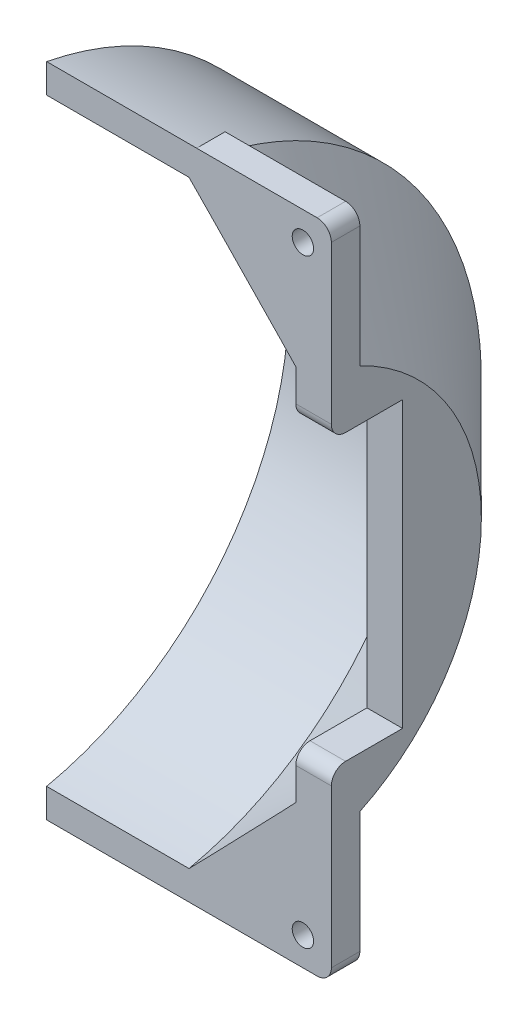
from build123d import *

# Parameters (mm, degrees)
CUT_EXTRUDE1_DEPTH      = 78.575769413
CUT_EXTRUDE1_DEPTH_BACK = 9
SKETCH2_W               = 40
SKETCH2_H               = 94
SKETCH3_W               = 10
SKETCH3_H               = 40
CUT_EXTRUDE2_DEPTH      = 78.05193054
SKETCH4_R               = 1.5
BOSS_EXTRUDE1_DEPTH     = 4
MOVE_START              = -46.130250379
MOVE_FACE1_OUTLINE_W    = 16.928932188
MOVE_FACE1_OUTLINE_H    = 4
MOVE_FACE1_DEPTH        = 0.963891216
MOVE_START_2            = 45.166359163
MOVE_FACE1_2_OUTLINE_W  = 16.928932188
MOVE_FACE1_2_OUTLINE_H  = 4
MOVE_FACE1_2_DEPTH      = 0.963891216
MOVE_START_3            = -28.692666648
MOVE_FACE1_3_DEPTH      = 1.57682047
MOVE_START_4            = 27.115846178
MOVE_FACE1_4_DEPTH      = 1.57682047
FILLET1_R               = 2


with BuildPart() as part:
    # Sketch1 → Revolve1 (revolve)
    with BuildSketch(Plane.XY, mode=Mode.PRIVATE) as revolve1_sk:
        Polygon((0, 47), (23.071067812, 47), (40, 30.071067812), (40, 0), (35, 0), (35, 28), (20, 43), (0, 43), align=None)
    revolve(revolve1_sk.sketch.rotate(Axis((0, 0, 0), (1, 0, 0)), 90), axis=Axis((0, 0, 0), (1, 0, 0)))

    # Sketch2 → Cut-Extrude1 (cut, two sides: drawn at the far end of the back side and taken through both)
    with BuildSketch(Plane.XY.offset(-CUT_EXTRUDE1_DEPTH_BACK)):
        with Locations((20, 0)):
            Rectangle(SKETCH2_W, SKETCH2_H)
    extrude(amount=CUT_EXTRUDE1_DEPTH + CUT_EXTRUDE1_DEPTH_BACK, mode=Mode.SUBTRACT)

    # Sketch3 → Cut-Extrude2 (cut, through all)
    with BuildSketch(Plane(origin=(40, 0, 0), x_dir=(0, 0, -1), z_dir=(1, 0, 0))):
        with Locations((14, 0)):
            Rectangle(SKETCH3_W, SKETCH3_H)
    extrude(amount=-CUT_EXTRUDE2_DEPTH, mode=Mode.SUBTRACT)

    # Sketch4 → Boss-Extrude1 (add)
    # profile 1 of 2: a face of its own
    with BuildSketch(Plane.XY.offset(-9)):
        with BuildLine():
            Line((23.071067812, 46.130250379), (38, 46.130250379))
            ThreePointArc((38, 46.130250379), (39.414213562, 45.544463941), (40, 44.130250379))
            Line((40, 44.130250379), (40, 28.692666648))
            Line((40, 28.692666648), (32.929135877, 28.692666648))
            Line((32.929135877, 28.692666648), (23.071067812, 38.901502546))
            Line((23.071067812, 38.901502546), (23.071067812, 46.130250379))
        make_face()
        with Locations((36, 42.130250379)):
            Circle(SKETCH4_R, mode=Mode.SUBTRACT)
    # profile 2 of 2: a face of its own
    with BuildSketch(Plane.XY.offset(-9)):
        with BuildLine():
            Line((23.071067812, -38.901502546), (23.071067812, -46.130250379))
            Line((23.071067812, -46.130250379), (38, -46.130250379))
            ThreePointArc((38, -46.130250379), (39.414213562, -45.544463941), (40, -44.130250379))
            Line((40, -44.130250379), (40, -28.692666648))
            Line((40, -28.692666648), (32.929135877, -28.692666648))
            Line((32.929135877, -28.692666648), (23.071067812, -38.901502546))
        make_face()
        with Locations(Location((36, -42.130250379, 0), (0, 0, 180))):
            Circle(SKETCH4_R, mode=Mode.SUBTRACT)
    extrude(amount=-BOSS_EXTRUDE1_DEPTH)


with BuildPart() as move_face1_tool:
    # Move Face1: read off the stored shape, not the designer's step
    # Move Face1 outline → Move Face1 (new body)
    with BuildSketch(Plane(origin=(0, 0, 0), x_dir=(1, 0, 0), z_dir=(0, 1, 0)).offset(MOVE_START)):
        with Locations((29.535533906, 11)):
            Rectangle(MOVE_FACE1_OUTLINE_W, MOVE_FACE1_OUTLINE_H)
    extrude(amount=MOVE_FACE1_DEPTH)


with BuildPart() as part_1:
    add(part.part)


with BuildPart() as part_2:
    # Move Face1: joined with move_face1_tool
    add(part_1.part.fuse(move_face1_tool.part, tol=0.00001))


with BuildPart() as move_face1_2_tool:
    # Move Face1 2 outline → Move Face1 2 (new body)
    with BuildSketch(Plane(origin=(0, 0, 0), x_dir=(1, 0, 0), z_dir=(0, 1, 0)).offset(MOVE_START_2)):
        with Locations((29.535533906, 11)):
            Rectangle(MOVE_FACE1_2_OUTLINE_W, MOVE_FACE1_2_OUTLINE_H)
    extrude(amount=MOVE_FACE1_2_DEPTH)


with BuildPart() as part_3:
    add(part_2.part)


with BuildPart() as part_4:
    # Move Face1 2: joined with move_face1_2_tool
    add(part_3.part.fuse(move_face1_2_tool.part, tol=0.00001))


with BuildPart() as move_face1_3_tool:
    # Move Face1 3 outline → Move Face1 3 (new body)
    with BuildSketch(Plane(origin=(0, 0, 0), x_dir=(1, 0, 0), z_dir=(0, 1, 0)).offset(MOVE_START_3)):
        with BuildLine():
            Line((40, 13), (38.57076781, 13.000001435))
            add(Edge.make_bspline(
                [(38.57076781, 13.000001435), (38.71437599, 12.652027053), (38.853897492, 12.302357037), (39.340707465, 11.036237384), (39.662536412, 10.10974197), (39.965458557, 9.114909953), (39.982798274, 9.057475387), (40.00000015, 9.000000045)],
                knots=[15.019424216, 15.019424216, 15.019424216, 15.019424216, 16.148697383, 16.148697383, 19.088168409, 19.088168409, 19.268134003, 19.268134003, 19.268134003, 19.268134003], degree=3))
            Line((40.00000015, 9.000000045), (40, 13))
        make_face()
    extrude(amount=MOVE_FACE1_3_DEPTH)


with BuildPart() as part_5:
    add(part_4.part)


with BuildPart() as part_6:
    # Move Face1 3: joined with move_face1_3_tool
    add(part_5.part.fuse(move_face1_3_tool.part, tol=0.00001))


with BuildPart() as move_face1_4_tool:
    # Move Face1 4 outline → Move Face1 4 (new body)
    with BuildSketch(Plane(origin=(0, 0, 0), x_dir=(1, 0, 0), z_dir=(0, 1, 0)).offset(MOVE_START_4)):
        with BuildLine():
            Line((40, 13), (38.57076781, 13.000001435))
            add(Edge.make_bspline(
                [(38.57076781, 13.000001435), (38.71437599, 12.652027053), (38.853897492, 12.302357037), (39.340707465, 11.036237384), (39.662536412, 10.10974197), (39.965458557, 9.114909953), (39.982798274, 9.057475387), (40.00000015, 9.000000045)],
                knots=[15.019424216, 15.019424216, 15.019424216, 15.019424216, 16.148697383, 16.148697383, 19.088168409, 19.088168409, 19.268134003, 19.268134003, 19.268134003, 19.268134003], degree=3))
            Line((40.00000015, 9.000000045), (40, 13))
        make_face()
    extrude(amount=MOVE_FACE1_4_DEPTH)


with BuildPart() as part_7:
    add(part_6.part)


with BuildPart() as part_8:
    # Move Face1 4: joined with move_face1_4_tool
    add(part_7.part.fuse(move_face1_4_tool.part, tol=0.00001))

    # Fillet1
    fillet1_edges = [part_8.edges().sort_by_distance(p)[0] for p in [
        (37.5, -20, -9),
        (37.5, 20, -9),
    ]]
    fillet(fillet1_edges, radius=FILLET1_R)


solid = part_8.part
